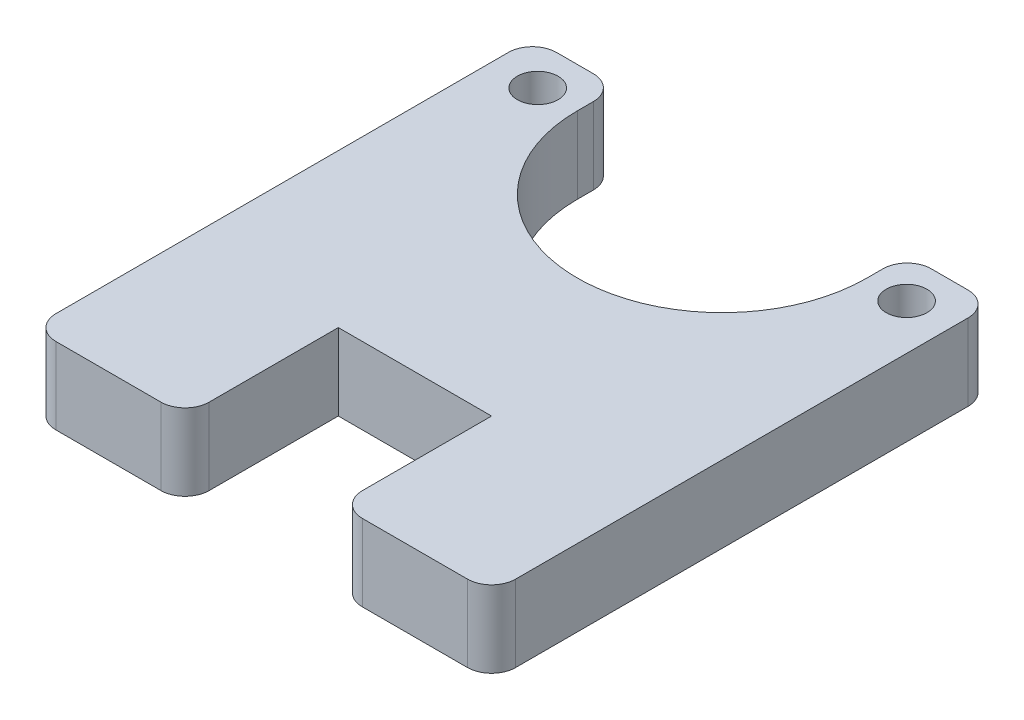
from build123d import *

# Parameters (mm, degrees)
SKETCH1_R        = 0.8449945
MOUNT_BODY_DEPTH = 3.175
FILLET3_R        = 1


with BuildPart() as part:
    # Sketch1 → Mount Body (new body)
    with BuildSketch(Plane(origin=(0, 0, 0), x_dir=(1, 0, 0), z_dir=(0, 1, 0))):
        with BuildLine():
            Line((0, -6.35), (6.35, -6.35))
            Line((6.35, -6.35), (6.35, 0))
            Line((6.35, 0), (12.7, 0))
            Line((12.7, 0), (12.7, -6.35))
            Line((12.7, -6.35), (19.05, -6.35))
            Line((19.05, -6.35), (19.05, 14.393639996))
            Line((19.05, 14.393639996), (15.5250007, 14.393639996))
            Line((15.5250007, 14.393639996), (15.5250007, 12.728637738))
            ThreePointArc((15.5250007, 12.728637738), (9.524996571, 6.728637038), (3.5249993, 12.728644596))
            Line((3.5249993, 12.728644596), (3.5249993, 14.393639996))
            Line((3.5249993, 14.393639996), (0, 14.393639996))
            Line((0, 14.393639996), (0, -6.35))
        make_face()
        with Locations((1.88250068, 12.728644596)):
            Circle(SKETCH1_R, mode=Mode.SUBTRACT)
        with Locations((17.16749932, 12.728637738)):
            Circle(SKETCH1_R, mode=Mode.SUBTRACT)
    extrude(amount=MOUNT_BODY_DEPTH)

    # Fillet3
    fillet3_edges = [part.edges().sort_by_distance(p)[0] for p in [
        (19.05, 1.5875, 6.35),
        (12.7, 1.5875, 6.35),
        (6.35, 1.5875, 6.35),
        (0, 1.5875, 6.35),
        (19.05, 1.5875, -14.393639996),
        (15.5250007, 1.5875, -14.393639996),
        (3.5249993, 1.5875, -14.393639996),
        (0, 1.5875, -14.393639996),
    ]]
    fillet(fillet3_edges, radius=FILLET3_R)


solid = part.part
